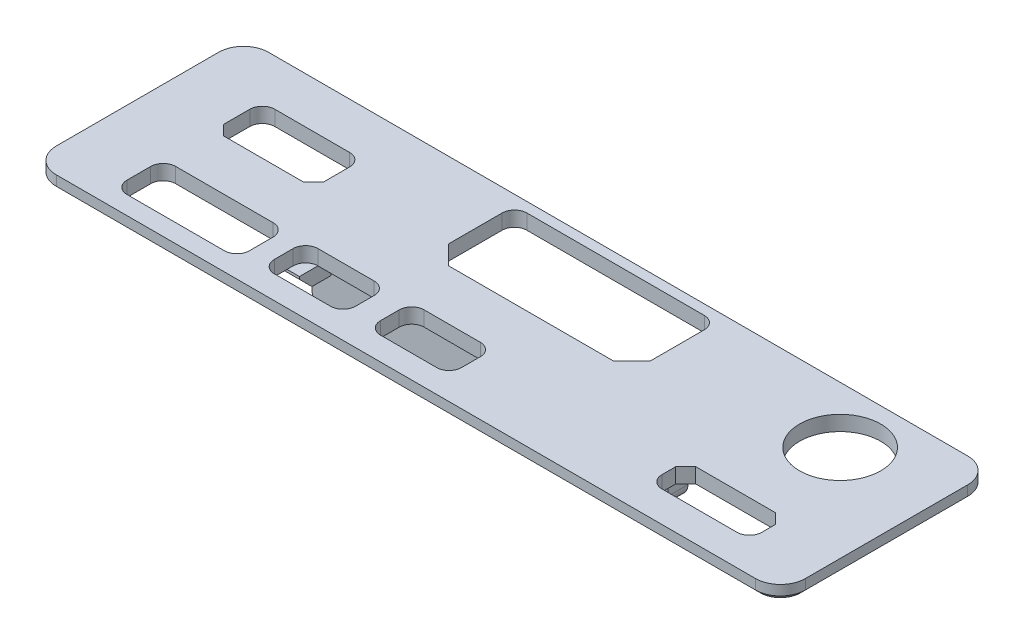
from build123d import *

# Parameters (mm, degrees)
SKETCH_1_W          = 60
SKETCH_1_H          = 17
EXTRUDE_1_DEPTH     = 1.2
CUT_EXTRUDE_1_REACH = 33.204
SKETCH_4_R          = 3.25
SKETCH_4_W          = 8
SKETCH_4_H          = 3.9
SKETCH_4_W_2        = 16.2
SKETCH_4_H_2        = 6.8
SKETCH_4_H_3        = 2.9
SKETCH_4_W_3        = 6.5
SKETCH_4_H_4        = 3.5
SKETCH_4_W_4        = 9.8
FILLET_2_R          = 1
CHAMFER_1_SIZE      = 0.8
SKETCH_5_W          = 1.5
SKETCH_5_H          = 8
EXTRUDE_2_DEPTH     = 1.2
SKETCH_6_W          = 28.5
SKETCH_6_H          = 1.6
EXTRUDE_3_DEPTH     = 4
FILLET_3_R          = 1
CHAMFER_2_SIZE      = 1
FILLET_4_R          = 2
CHAMFER_5_SIZE      = 0.4
CHAMFER_6_SIZE      = 1.5


with BuildPart() as part:
    # 草图1 → 凸台-拉伸1 (new body)
    with BuildSketch(Plane(origin=(0, 0, 0), x_dir=(1, 0, 0), z_dir=(0, 1, 0))):
        Rectangle(SKETCH_1_W, SKETCH_1_H)
    extrude(amount=EXTRUDE_1_DEPTH)

    # 草图4 → 切除-拉伸1 (cut, up to next)
    with BuildSketch(Plane(origin=(0, 1.2, 0), x_dir=(1, 0, 0), z_dir=(0, 1, 0)), mode=Mode.PRIVATE) as cut_extrude_1_sk1:
        with Locations((22.298485985, 3.98318929)):
            Circle(SKETCH_4_R)
    cut_extrude_1_tool1 = extrude(cut_extrude_1_sk1.sketch, amount=-CUT_EXTRUDE_1_REACH, mode=Mode.PRIVATE) & part.part
    # 草图4 → 切除-拉伸1 (cut, up to next)
    with BuildSketch(Plane(origin=(0, 1.2, 0), x_dir=(1, 0, 0), z_dir=(0, 1, 0)), mode=Mode.PRIVATE) as cut_extrude_1_sk2:
        with Locations((-20.8, 2.85)):
            Rectangle(SKETCH_4_W, SKETCH_4_H)
    cut_extrude_1_tool2 = extrude(cut_extrude_1_sk2.sketch, amount=-CUT_EXTRUDE_1_REACH, mode=Mode.PRIVATE) & part.part
    # 草图4 → 切除-拉伸1 (cut, up to next)
    with BuildSketch(Plane(origin=(0, 1.2, 0), x_dir=(1, 0, 0), z_dir=(0, 1, 0)), mode=Mode.PRIVATE) as cut_extrude_1_sk3:
        with Locations((0.6, 4.3)):
            Rectangle(SKETCH_4_W_2, SKETCH_4_H_2)
    cut_extrude_1_tool3 = extrude(cut_extrude_1_sk3.sketch, amount=-CUT_EXTRUDE_1_REACH, mode=Mode.PRIVATE) & part.part
    # 草图4 → 切除-拉伸1 (cut, up to next)
    with BuildSketch(Plane(origin=(0, 1.2, 0), x_dir=(1, 0, 0), z_dir=(0, 1, 0)), mode=Mode.PRIVATE) as cut_extrude_1_sk4:
        with Locations((21.05, -4.584803861)):
            Rectangle(SKETCH_4_W, SKETCH_4_H_3)
    cut_extrude_1_tool4 = extrude(cut_extrude_1_sk4.sketch, amount=-CUT_EXTRUDE_1_REACH, mode=Mode.PRIVATE) & part.part
    # 草图4 → 切除-拉伸1 (cut, up to next)
    with BuildSketch(Plane(origin=(0, 1.2, 0), x_dir=(1, 0, 0), z_dir=(0, 1, 0)), mode=Mode.PRIVATE) as cut_extrude_1_sk5:
        with Locations((-1.65, -4.884803861)):
            Rectangle(SKETCH_4_W_3, SKETCH_4_H_4)
    cut_extrude_1_tool5 = extrude(cut_extrude_1_sk5.sketch, amount=-CUT_EXTRUDE_1_REACH, mode=Mode.PRIVATE) & part.part
    # 草图4 → 切除-拉伸1 (cut, up to next)
    with BuildSketch(Plane(origin=(0, 1.2, 0), x_dir=(1, 0, 0), z_dir=(0, 1, 0)), mode=Mode.PRIVATE) as cut_extrude_1_sk6:
        with Locations((-10.15, -4.884803861)):
            Rectangle(SKETCH_4_W_3, SKETCH_4_H_4)
    cut_extrude_1_tool6 = extrude(cut_extrude_1_sk6.sketch, amount=-CUT_EXTRUDE_1_REACH, mode=Mode.PRIVATE) & part.part
    # 草图4 → 切除-拉伸1 (cut, up to next)
    with BuildSketch(Plane(origin=(0, 1.2, 0), x_dir=(1, 0, 0), z_dir=(0, 1, 0)), mode=Mode.PRIVATE) as cut_extrude_1_sk7:
        with Locations((-19.9, -5.084803861)):
            Rectangle(SKETCH_4_W_4, SKETCH_4_H)
    cut_extrude_1_tool7 = extrude(cut_extrude_1_sk7.sketch, amount=-CUT_EXTRUDE_1_REACH, mode=Mode.PRIVATE) & part.part
    add(cut_extrude_1_tool1.solids().sort_by_distance((22.298486, 1.2, -3.983189))[0], mode=Mode.SUBTRACT)
    add(cut_extrude_1_tool2.solids().sort_by_distance((-20.8, 1.2, -2.85))[0], mode=Mode.SUBTRACT)
    add(cut_extrude_1_tool3.solids().sort_by_distance((0.6, 1.2, -4.3))[0], mode=Mode.SUBTRACT)
    add(cut_extrude_1_tool4.solids().sort_by_distance((21.05, 1.2, 4.584804))[0], mode=Mode.SUBTRACT)
    add(cut_extrude_1_tool5.solids().sort_by_distance((-1.65, 1.2, 4.884804))[0], mode=Mode.SUBTRACT)
    add(cut_extrude_1_tool6.solids().sort_by_distance((-10.15, 1.2, 4.884804))[0], mode=Mode.SUBTRACT)
    add(cut_extrude_1_tool7.solids().sort_by_distance((-19.9, 1.2, 5.084804))[0], mode=Mode.SUBTRACT)

    # 圆角2
    fillet_2_edges = [part.edges().sort_by_distance(p)[0] for p in [
        (-24.8, 0.6, -4.8),
        (-16.8, 0.6, -4.8),
        (8.7, 0.6, -7.7),
        (-7.5, 0.6, -7.7),
        (25.05, 0.6, 6.034803861),
        (17.05, 0.6, 6.034803861),
        (1.6, 0.6, 6.634803861),
        (1.6, 0.6, 3.134803861),
        (-4.9, 0.6, 3.134803861),
        (-4.9, 0.6, 6.634803861),
        (-6.9, 0.6, 6.634803861),
        (-6.9, 0.6, 3.134803861),
        (-13.4, 0.6, 3.134803861),
        (-13.4, 0.6, 6.634803861),
        (-15, 0.6, 7.034803861),
        (-15, 0.6, 3.134803861),
        (-24.8, 0.6, 3.134803861),
        (-24.8, 0.6, 7.034803861),
    ]]
    fillet(fillet_2_edges, radius=FILLET_2_R)

    # 倒角1
    chamfer_1_edges = [part.edges().sort_by_distance(p)[0] for p in [
        (17.05, 0.6, 3.134803861),
        (25.05, 0.6, 3.134803861),
        (-16.8, 0.6, -0.9),
        (-24.8, 0.6, -0.9),
    ]]
    chamfer(chamfer_1_edges, length=CHAMFER_1_SIZE)

    # 草图5 → 凸台-拉伸2 (add)
    with BuildSketch(Plane.XZ):
        with Locations((-13.15891381, 0.61681071)):
            Rectangle(SKETCH_5_W, SKETCH_5_H)
        with Locations((13.84108619, 0.61681071)):
            Rectangle(SKETCH_5_W, SKETCH_5_H)
    extrude(amount=EXTRUDE_2_DEPTH)

    # 草图6 → 凸台-拉伸3 (add)
    with BuildSketch(Plane.XZ):
        with Locations((0.34108619, 1.3)):
            Rectangle(SKETCH_6_W, SKETCH_6_H)
    extrude(amount=EXTRUDE_3_DEPTH)

    # 圆角3
    fillet_3_edges = [part.edges().sort_by_distance(p)[0] for p in [
        (14.59108619, -4, 1.3),
        (-13.90891381, -4, 1.3),
    ]]
    fillet(fillet_3_edges, radius=FILLET_3_R)

    # 倒角2
    chamfer_2_edges = [part.edges().sort_by_distance(p)[0] for p in [
        (13.84108619, -1.2, -3.38318929),
        (-13.15891381, -1.2, -3.38318929),
        (13.84108619, -1.2, 4.61681071),
        (-13.15891381, -1.2, 4.61681071),
    ]]
    chamfer(chamfer_2_edges, length=CHAMFER_2_SIZE)

    # 圆角4
    fillet_4_edges = [part.edges().sort_by_distance(p)[0] for p in [
        (30, 0.6, 8.5),
        (30, 0.6, -8.5),
        (-30, 0.6, 8.5),
        (-30, 0.6, -8.5),
    ]]
    fillet(fillet_4_edges, radius=FILLET_4_R)

    # 倒角5
    chamfer_5_edges = [part.edges().sort_by_distance(p)[0] for p in [
        (0, 0, -8.5),
        (-29.414213562, 0, -7.914213562),
        (29.414213562, 0, -7.914213562),
        (-30, 0, 0),
        (30, 0, 0),
        (-29.414213562, 0, 7.914213562),
        (29.414213562, 0, 7.914213562),
        (0, 0, 8.5),
    ]]
    chamfer(chamfer_5_edges, length=CHAMFER_5_SIZE)

    # 倒角6
    chamfer_6_edges = [part.edges().sort_by_distance(p)[0] for p in [
        (8.7, 0.6, -0.9),
        (-7.5, 0.6, -0.9),
    ]]
    chamfer(chamfer_6_edges, length=CHAMFER_6_SIZE)


solid = part.part
